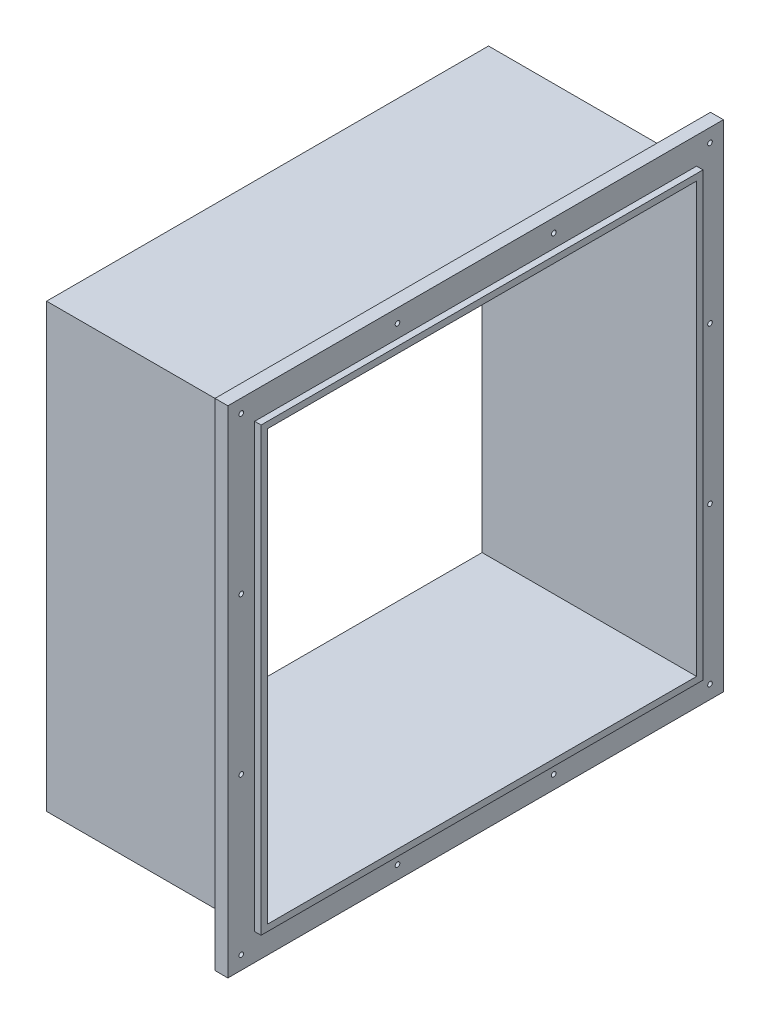
from build123d import *

# Parameters (mm, degrees)
SKETCH1_W           = 412
SKETCH1_H           = 412
SKETCH1_W_2         = 400
SKETCH1_H_2         = 400
EXTRUDE_THIN1_DEPTH = 200
SKETCH5_W           = 462
SKETCH5_H           = 462
SKETCH5_W_2         = 412
SKETCH5_H_2         = 412
EXTRUDE_THIN2_DEPTH = 12
SKETCH6_R           = 2.15
CUT_EXTRUDE1_DEPTH  = 380.944732823


with BuildPart() as part:
    # Sketch1 → Extrude-Thin1 (new body)
    with BuildSketch(Plane(origin=(0, 0, 0), x_dir=(0, 0, -1), z_dir=(1, 0, 0))):
        Rectangle(SKETCH1_W, SKETCH1_H)
        Rectangle(SKETCH1_W_2, SKETCH1_H_2, mode=Mode.SUBTRACT)
    extrude(amount=EXTRUDE_THIN1_DEPTH)

    # Sketch5 → Extrude-Thin2 (add)
    with BuildSketch(Plane(origin=(194, 0, 0), x_dir=(0, 0, -1), z_dir=(1, 0, 0))):
        Rectangle(SKETCH5_W, SKETCH5_H)
        Rectangle(SKETCH5_W_2, SKETCH5_H_2, mode=Mode.SUBTRACT)
    extrude(amount=-EXTRUDE_THIN2_DEPTH)

    # Sketch6 → Cut-Extrude1 (cut, through all)
    with BuildSketch(Plane(origin=(194, 0, 0), x_dir=(0, 0, -1), z_dir=(1, 0, 0))):
        with Locations((-218.5, 218.5)):
            Circle(SKETCH6_R)
        with Locations((-72.83, 218.5)):
            Circle(SKETCH6_R)
        with Locations((72.84, 218.5)):
            Circle(SKETCH6_R)
        with Locations((-218.5, 72.83)):
            Circle(SKETCH6_R)
        with Locations((-218.5, -72.84)):
            Circle(SKETCH6_R)
        with Locations((218.5, 218.5)):
            Circle(SKETCH6_R)
        with Locations((218.5, -218.5)):
            Circle(SKETCH6_R)
        with Locations((72.84, -218.5)):
            Circle(SKETCH6_R)
        with Locations((-72.83, -218.5)):
            Circle(SKETCH6_R)
        with Locations((-218.5, -218.5)):
            Circle(SKETCH6_R)
        with Locations((218.5, 72.83)):
            Circle(SKETCH6_R)
        with Locations((218.5, -72.84)):
            Circle(SKETCH6_R)
    extrude(amount=-CUT_EXTRUDE1_DEPTH, mode=Mode.SUBTRACT)


solid = part.part
